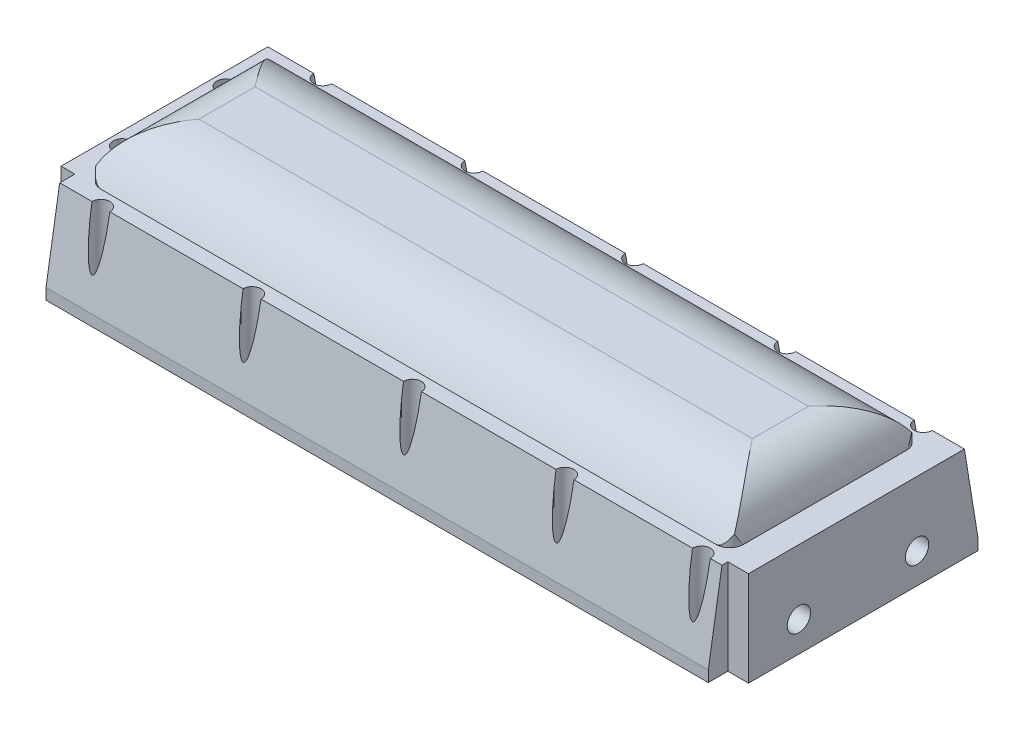
from build123d import *

# Parameters (mm, degrees)
SALIENTE_EXTRUIR1_DEPTH                              = 100
CROQUIS3_W                                           = 20.92
CROQUIS3_H                                           = 92
CORTAR_EXTRUIR1_DEPTH                                = 798
CROQUIS4_W                                           = 19.08
CROQUIS4_H                                           = 92
CROQUIS4_W_2                                         = 20.25
CORTAR_EXTRUIR2_DEPTH                                = 798
CROQUIS5_W                                           = 465.67
CROQUIS5_H                                           = 136.54
CORTAR_EXTRUIR3_DEPTH                                = 69
REFRENTADO_PARA_PERNO_CON_CABEZA_HEXAGON_D           = 10.5
REFRENTADO_PARA_PERNO_CON_CABEZA_HEXAGON_DEPTH       = 90
REFRENTADO_PARA_PERNO_CON_CABEZA_HEXAGON_CBORE_D     = 13
REFRENTADO_PARA_PERNO_CON_CABEZA_HEXAGON_CBORE_DEPTH = 6.85
REFRENTADO_PARA_PERNO_CON_CABEZA_HEXAGON_TIP         = 3.15451825
CROQUIS8_R                                           = 8.5
CORTAR_EXTRUIR4_DEPTH                                = 69
CORTAR_EXTRUIR5_DEPTH                                = 607
CORTAR_EXTRUIR6_START                                = -138.5400001
CORTAR_EXTRUIR6_DEPTH                                = 138.5400001
REDONDEO1_R                                          = 10
REDONDEO2_R                                          = 10
REDONDEO3_R                                          = 10
REDONDEO4_R                                          = 10
REDONDEO5_R                                          = 10
CHAFL_N1_SIZE                                        = 1
REDONDEO6_R                                          = 10
SALIENTE_EXTRUIR2_DEPTH                              = 61
CROQUIS12_R                                          = 6.5
CORTAR_EXTRUIR7_DEPTH                                = 61
CORTAR_EXTRUIR8_DEPTH                                = 630
CORTAR_EXTRUIR9_START                                = -630
CROQUIS14_R                                          = 8.5
CORTAR_EXTRUIR9_DEPTH                                = 630


# Read off the part's stored shape, not the designer's step: Cortar-Extruir6
# Some blends are built 0.0001 mm under size
with BuildPart() as part:
    # Croquis2 → Saliente-Extruir1 (new body)
    with BuildSketch(Plane(origin=(0, 0, 0), x_dir=(1, 0, 0), z_dir=(0, 1, 0))):
        Polygon((-10, 20.92), (-10, 181.28), (497, 181.28), (497, 14.25), (482, 14.25), (482, 0), (0, 0), (0, 20.92), align=None)
    extrude(amount=SALIENTE_EXTRUIR1_DEPTH)

    # Croquis3 → Cortar-Extruir1 (cut)
    with BuildSketch(Plane.ZY.offset(10)):
        Polygon((-181.28, 100), (-181.28, 8), (-159.46, 8), (-159.46, 100), (-159.605192294, 100), align=None)
        with Locations((-10.46, 54)):
            Rectangle(CROQUIS3_W, CROQUIS3_H)
    extrude(amount=-CORTAR_EXTRUIR1_DEPTH, mode=Mode.SUBTRACT)

    # Croquis4 → Cortar-Extruir2 (cut)
    with BuildSketch(Plane(origin=(0, 0, -159.46), x_dir=(-1, 0, 0), z_dir=(0, 0, -1))):
        with Locations((0.46, 54)):
            Rectangle(CROQUIS4_W, CROQUIS4_H)
        with Locations((-486.875, 54)):
            Rectangle(CROQUIS4_W_2, CROQUIS4_H)
    extrude(amount=-CORTAR_EXTRUIR2_DEPTH, mode=Mode.SUBTRACT)

    # Croquis5 → Cortar-Extruir3 (cut)
    with BuildSketch(Plane.XZ):
        with Locations((242.915, -90.19)):
            Rectangle(CROQUIS5_W, CROQUIS5_H)
    extrude(amount=-CORTAR_EXTRUIR3_DEPTH, mode=Mode.SUBTRACT)

    # Refrentado para perno con cabeza hexagonal de M101
    with Locations(Plane(origin=(-0.5, 8, -131.28), x_dir=(0, 0, 1), z_dir=(0, 1, 0))):
        with Locations((0, 0), (75.36, 0), (121.325, 30.5), (121.325, 140.5), (121.325, 257.25), (121.325, 368.25), (121.325, 467.5), (-40.125, 467.5), (-40.125, 368.25), (-40.125, 257.25), (-40.125, 140.5), (-40.125, 30.5)):
            CounterBoreHole(REFRENTADO_PARA_PERNO_CON_CABEZA_HEXAGON_D / 2, REFRENTADO_PARA_PERNO_CON_CABEZA_HEXAGON_CBORE_D / 2, REFRENTADO_PARA_PERNO_CON_CABEZA_HEXAGON_CBORE_DEPTH, depth=REFRENTADO_PARA_PERNO_CON_CABEZA_HEXAGON_DEPTH)
            with Locations((0, 0, -(REFRENTADO_PARA_PERNO_CON_CABEZA_HEXAGON_DEPTH + REFRENTADO_PARA_PERNO_CON_CABEZA_HEXAGON_TIP / 2))):  # 118° drill point
                Cone(0, REFRENTADO_PARA_PERNO_CON_CABEZA_HEXAGON_D / 2, REFRENTADO_PARA_PERNO_CON_CABEZA_HEXAGON_TIP, mode=Mode.SUBTRACT)

    # Croquis8 → Cortar-Extruir4 (cut)
    with BuildSketch(Plane(origin=(476.75, 0, 0), x_dir=(0, 0, -1), z_dir=(1, 0, 0))):
        with Locations((50.94, 22)):
            Circle(CROQUIS8_R)
        with Locations((136.94, 22)):
            Circle(CROQUIS8_R)
    extrude(amount=-CORTAR_EXTRUIR4_DEPTH, mode=Mode.SUBTRACT)

    # Croquis9 → Cortar-Extruir5 (cut)
    with BuildSketch(Plane(origin=(476.75, 0, 0), x_dir=(0, 0, -1), z_dir=(1, 0, 0))):
        with BuildLine():
            Line((20.92, 69), (20.92, 100))
            Line((20.92, 100), (69.776934001, 100))
            ThreePointArc((69.776934001, 100), (40.845981718, 91.596052461), (20.92, 69))
        make_face()
        with BuildLine():
            Line((110.603065999, 100), (159.46, 100))
            Line((159.46, 100), (159.46, 69))
            ThreePointArc((159.46, 69), (139.534018282, 91.596052461), (110.603065999, 100))
        make_face()
    extrude(amount=-CORTAR_EXTRUIR5_DEPTH, mode=Mode.SUBTRACT)

    # Cortar-Extruir6 outline → Cortar-Extruir6 (cut)
    with BuildSketch(Plane.XY.offset(-20.92).offset(CORTAR_EXTRUIR6_START)):
        with BuildLine():
            Line((476.75, 100), (444.284633839, 100))
            ThreePointArc((444.284633839, 100), (466.729009526, 91.005318547), (476.75, 69))
            Line((476.75, 69), (476.75, 100))
        make_face()
        with BuildLine():
            ThreePointArc((9.08, 69), (19.100990474, 91.005318547), (41.545366161, 100))
            Line((41.545366161, 100), (9.08, 100))
            Line((9.08, 100), (9.08, 69))
        make_face()
    extrude(amount=CORTAR_EXTRUIR6_DEPTH, mode=Mode.SUBTRACT)

    # Redondeo1
    redondeo1_edges = [part.edges().sort_by_distance(p)[0] for p in [
        (475.75, 69, -90.19),
        (242.915, 69, -158.46),
        (10.08, 69, -90.19),
        (242.915, 69, -21.92),
    ]]
    fillet(redondeo1_edges, radius=REDONDEO1_R)

    # Redondeo2
    # the kernel refuses this fillet: 10 mm, written as the material it adds along each edge
    with BuildSketch(Plane(origin=(20.08, 59, -31.92), x_dir=(-1, 0, 0), z_dir=(0, 0, 1))) as redondeo2_piece_1_section:
        Polygon((0, 0), (REDONDEO2_R, 0), (REDONDEO2_R, -REDONDEO2_R), (0, -REDONDEO2_R), align=None)
    redondeo2_piece_1 = extrude(amount=REDONDEO2_R, mode=Mode.PRIVATE)
    redondeo2_piece_1 = redondeo2_piece_1 - Plane(origin=(20.08, 59, -31.92), x_dir=(0.7071067811865475, -0.7071067811865475, 0), z_dir=(0, 0, 1)) * Sphere(REDONDEO2_R, mode=Mode.PRIVATE)
    add(redondeo2_piece_1)
    with BuildSketch(Plane(origin=(10.08, 0, -21.92), x_dir=(1, 0, 0), z_dir=(0, 1, 0))) as redondeo2_piece_2:
        with BuildLine():
            CenterArc((REDONDEO2_R, REDONDEO2_R), REDONDEO2_R, 180, 90)
            Line((0, REDONDEO2_R), (0, 0))
            Line((0, 0), (REDONDEO2_R, 0))
        make_face()
    extrude(amount=59)

    # Redondeo3
    # the kernel refuses this fillet: 10 mm, written as the material it adds along each edge
    with BuildSketch(Plane(origin=(465.75, 59, -31.92), x_dir=(1, 0, 0), z_dir=(0, 0, 1))) as redondeo3_piece_1_section:
        Polygon((0, 0), (REDONDEO3_R, 0), (REDONDEO3_R, REDONDEO3_R), (0, REDONDEO3_R), align=None)
    redondeo3_piece_1 = extrude(amount=REDONDEO3_R, mode=Mode.PRIVATE)
    redondeo3_piece_1 = redondeo3_piece_1 - Plane(origin=(465.75, 59, -31.92), x_dir=(-0.7071067811865475, -0.7071067811865475, 0), z_dir=(0, 0, 1)) * Sphere(REDONDEO3_R, mode=Mode.PRIVATE)
    add(redondeo3_piece_1)
    with BuildSketch(Plane(origin=(475.75, 0, -21.92), x_dir=(-1, 0, 0), z_dir=(0, 1, 0))) as redondeo3_piece_2:
        with BuildLine():
            CenterArc((REDONDEO3_R, -REDONDEO3_R), REDONDEO3_R, 90, 90)
            Line((0, -REDONDEO3_R), (0, 0))
            Line((0, 0), (REDONDEO3_R, 0))
        make_face()
    extrude(amount=59)

    # Redondeo4
    # the kernel refuses this fillet: 10 mm, written as the material it adds along each edge
    with BuildSketch(Plane(origin=(465.75, 59, -148.46), x_dir=(0, 0, -1), z_dir=(1, 0, 0))) as redondeo4_piece_1_section:
        Polygon((0, 0), (REDONDEO4_R, 0), (REDONDEO4_R, REDONDEO4_R), (0, REDONDEO4_R), align=None)
    redondeo4_piece_1 = extrude(amount=REDONDEO4_R, mode=Mode.PRIVATE)
    redondeo4_piece_1 = redondeo4_piece_1 - Plane(origin=(465.75, 59, -148.46), x_dir=(0, -0.7071067811865475, 0.7071067811865475), z_dir=(1, 0, 0)) * Sphere(REDONDEO4_R, mode=Mode.PRIVATE)
    add(redondeo4_piece_1)
    with BuildSketch(Plane(origin=(475.75, 0, -158.46), x_dir=(0, 0, 1), z_dir=(0, 1, 0))) as redondeo4_piece_2:
        with BuildLine():
            CenterArc((REDONDEO4_R, -REDONDEO4_R), REDONDEO4_R, 90, 90)
            Line((0, -REDONDEO4_R), (0, 0))
            Line((0, 0), (REDONDEO4_R, 0))
        make_face()
    extrude(amount=59)

    # Redondeo5
    # the kernel refuses this fillet: 10 mm, written as the material it adds along each edge
    with BuildSketch(Plane(origin=(20.08, 59, -148.46), x_dir=(-1, 0, 0), z_dir=(0, 0, -1))) as redondeo5_piece_1_section:
        Polygon((0, 0), (REDONDEO5_R, 0), (REDONDEO5_R, REDONDEO5_R), (0, REDONDEO5_R), align=None)
    redondeo5_piece_1 = extrude(amount=REDONDEO5_R, mode=Mode.PRIVATE)
    redondeo5_piece_1 = redondeo5_piece_1 - Plane(origin=(20.08, 59, -148.46), x_dir=(0.7071067811865475, -0.7071067811865475, 0), z_dir=(0, 0, -1)) * Sphere(REDONDEO5_R, mode=Mode.PRIVATE)
    add(redondeo5_piece_1)
    with BuildSketch(Plane(origin=(10.08, 0, -158.46), x_dir=(1, 0, 0), z_dir=(0, 1, 0))) as redondeo5_piece_2:
        with BuildLine():
            CenterArc((REDONDEO5_R, -REDONDEO5_R), REDONDEO5_R, 90, 90)
            Line((0, -REDONDEO5_R), (0, 0))
            Line((0, 0), (REDONDEO5_R, 0))
        make_face()
    extrude(amount=59)

    # Chaflán1
    chafl_n1_edges = [part.edges().sort_by_distance(p)[0] for p in [
        (475.75, 22, -42.44),
        (475.75, 22, -128.44),
    ]]
    chamfer(chafl_n1_edges, length=CHAFL_N1_SIZE - 0.0001)  # a hair under: the kernel refuses the full size

    # Redondeo6
    redondeo6_edges = [part.edges().sort_by_distance(p)[0] for p in [
        (9.08, 38.5, -20.92),
        (9.08, 38.5, -159.46),
        (476.75, 38.5, -20.92),
        (476.75, 38.5, -159.46),
    ]]
    fillet(redondeo6_edges, radius=REDONDEO6_R)

    # Croquis11 → Saliente-Extruir2 (add)
    with BuildSketch(Plane(origin=(0, 8, 0), x_dir=(1, 0, 0), z_dir=(0, 1, 0))):
        Polygon((482, 0), (482, 14.25), (497, 14.25), (497, 181.28), (-10, 181.28), (-10, 20.92), (0, 20.92), (0, 0), align=None)
        with BuildLine():
            Line((466.75, 20.92), (19.08, 20.92))
            ThreePointArc((19.08, 20.92), (12.008932188, 23.848932188), (9.08, 30.92))
            Line((9.08, 30.92), (9.08, 149.46))
            ThreePointArc((9.08, 149.46), (12.008932188, 156.531067812), (19.08, 159.46))
            Line((19.08, 159.46), (466.75, 159.46))
            ThreePointArc((466.75, 159.46), (473.821067812, 156.531067812), (476.75, 149.46))
            Line((476.75, 149.46), (476.75, 30.92))
            ThreePointArc((476.75, 30.92), (473.821067812, 23.848932188), (466.75, 20.92))
        make_face(mode=Mode.SUBTRACT)
    extrude(amount=SALIENTE_EXTRUIR2_DEPTH)

    # Croquis12 → Cortar-Extruir7 (cut)
    with BuildSketch(Plane(origin=(0, 69, 0), x_dir=(1, 0, 0), z_dir=(0, 1, 0))):
        with Locations(Location((30, 171.405, 0), (0, 0, 270))):
            Circle(CROQUIS12_R)
        with Locations(Location((-0.5, 131.28, 0), (0, 0, 270))):
            Circle(CROQUIS12_R)
        with Locations(Location((256.75, 171.405, 0), (0, 0, 270))):
            Circle(CROQUIS12_R)
        with Locations(Location((367.75, 171.405, 0), (0, 0, 270))):
            Circle(CROQUIS12_R)
        with Locations(Location((467, 171.405, 0), (0, 0, 270))):
            Circle(CROQUIS12_R)
        with Locations(Location((467, 9.955, 0), (0, 0, 270))):
            Circle(CROQUIS12_R)
        with Locations(Location((367.75, 9.955, 0), (0, 0, 270))):
            Circle(CROQUIS12_R)
        with Locations(Location((256.75, 9.955, 0), (0, 0, 270))):
            Circle(CROQUIS12_R)
        with Locations(Location((140, 9.955, 0), (0, 0, 270))):
            Circle(CROQUIS12_R)
        with Locations(Location((30, 9.955, 0), (0, 0, 270))):
            Circle(CROQUIS12_R)
        with Locations(Location((140, 171.405, 0), (0, 0, 270))):
            Circle(CROQUIS12_R)
        with Locations(Location((-0.5, 55.92, 0), (0, 0, 270))):
            Circle(CROQUIS12_R)
    extrude(amount=-CORTAR_EXTRUIR7_DEPTH, mode=Mode.SUBTRACT)

    # Croquis13 → Cortar-Extruir8 (cut)
    with BuildSketch(Plane.ZY.offset(10)):
        Polygon((-181.28, 8), (-171.405, 69), (-181.28, 69), align=None)
        Polygon((0, 8), (-9.955, 69), (0, 69), align=None)
    extrude(amount=-CORTAR_EXTRUIR8_DEPTH, mode=Mode.SUBTRACT)

    # Croquis14 → Cortar-Extruir9 (cut)
    with BuildSketch(Plane.ZY.offset(-476.75).offset(CORTAR_EXTRUIR9_START)):
        with Locations((-136.94, 22)):
            Circle(CROQUIS14_R)
        with Locations((-50.94, 22)):
            Circle(CROQUIS14_R)
    extrude(amount=CORTAR_EXTRUIR9_DEPTH, mode=Mode.SUBTRACT)


solid = part.part
